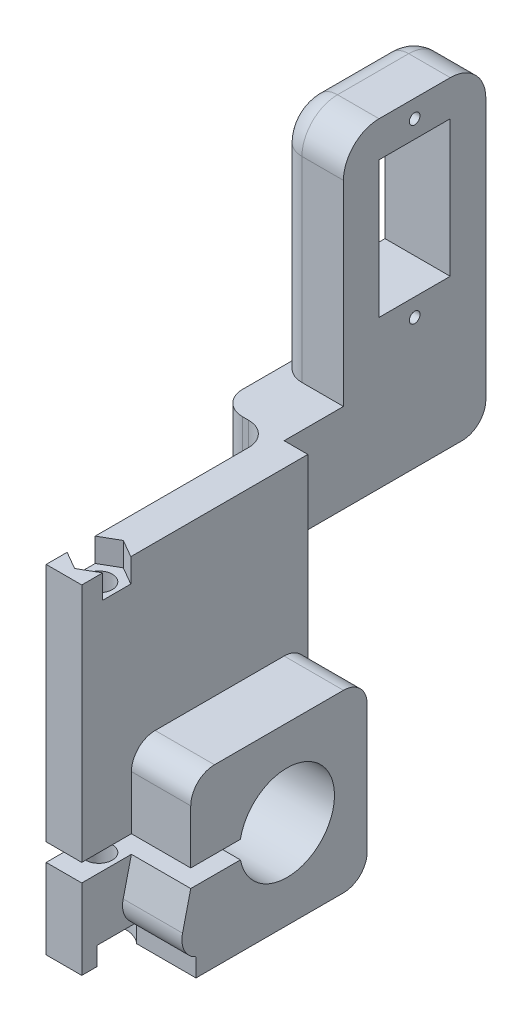
from build123d import *

# Parameters (mm, degrees)
SKETCH1_R                                        = 0.9
SKETCH1_W                                        = 12
SKETCH1_H                                        = 23
BOSS_EXTRUDE1_DEPTH                              = 15
CBORE_FOR_M4_PAN_HEAD_MACHINE_SCREW2_D           = 4.5
CBORE_FOR_M4_PAN_HEAD_MACHINE_SCREW2_CBORE_D     = 9
CBORE_FOR_M4_PAN_HEAD_MACHINE_SCREW2_CBORE_DEPTH = 3.1
CUT_EXTRUDE2_DEPTH                               = 4
SKETCH11_W                                       = 38.11
SKETCH11_H                                       = 57
CUT_EXTRUDE3_DEPTH                               = 9
FILLET3_R                                        = 6
FILLET4_R                                        = 4
BOSS_EXTRUDE2_DEPTH                              = 10
FILLET2_R                                        = 4
SKETCH14_W                                       = 40.700591816
SKETCH14_H                                       = 70
CUT_EXTRUDE4_DEPTH                               = 4


with BuildPart() as part:
    # Sketch1 → Boss-Extrude1 (new body)
    with BuildSketch(Plane(origin=(0, 0, 0), x_dir=(0, 0, -1), z_dir=(1, 0, 0))):
        with BuildLine():
            Line((-58.460295908, -42.411439664), (-41.718412731, -42.411439664))
            ThreePointArc((-41.718412731, -42.411439664), (-25.860295908, -43.911439664), (-41.718412731, -45.411439664))
            Line((-41.718412731, -45.411439664), (-58.460295908, -45.411439664))
            Line((-58.460295908, -45.411439664), (-58.460295908, -58.911439664))
            Line((-58.460295908, -58.911439664), (-20.350295908, -58.911439664))
            Line((-20.350295908, -58.911439664), (-20.350295908, -16.911439664))
            Line((-20.350295908, -16.911439664), (13.649704092, -16.911439664))
            Line((13.649704092, -16.911439664), (13.649704092, 37.088560336))
            Line((13.649704092, 37.088560336), (-10.350295908, 37.088560336))
            Line((-10.350295908, 37.088560336), (-10.350295908, -1.911439664))
            Line((-10.350295908, -1.911439664), (-58.460295908, -1.911439664))
            Line((-58.460295908, -1.911439664), (-58.460295908, -28.911439664))
            Line((-58.460295908, -28.911439664), (-58.460295908, -42.411439664))
        make_face()
        with Locations((1.649704092, 34.088560336)):
            Circle(SKETCH1_R, mode=Mode.SUBTRACT)
        with Locations((1.649704092, 5.088560336)):
            Circle(SKETCH1_R, mode=Mode.SUBTRACT)
        with Locations((1.649704092, 19.588560336)):
            Rectangle(SKETCH1_W, SKETCH1_H, mode=Mode.SUBTRACT)
    extrude(amount=BOSS_EXTRUDE1_DEPTH)

    # CBORE for M4 Pan Head Machine Screw2 (through all)
    with Locations(Plane(origin=(0, -58.911439664, 0), x_dir=(-1, 0, 0), z_dir=(0, -1, 0))):
        with Locations((-12, -52.560295908)):
            CounterBoreHole(CBORE_FOR_M4_PAN_HEAD_MACHINE_SCREW2_D / 2, CBORE_FOR_M4_PAN_HEAD_MACHINE_SCREW2_CBORE_D / 2, CBORE_FOR_M4_PAN_HEAD_MACHINE_SCREW2_CBORE_DEPTH)

    # Sketch7 → Cut-Extrude2 (cut)
    with BuildSketch(Plane(origin=(0, -1.911439664, 0), x_dir=(1, 0, 0), z_dir=(0, 1, 0))):
        Polygon((15.553380664, -50.516569118), (12.006771014, -48.461114589), (8.45339035, -50.504841379), (8.446619336, -54.604022698), (11.993228986, -56.659477227), (15.54660965, -54.615750437), align=None)
    extrude(amount=-CUT_EXTRUDE2_DEPTH, mode=Mode.SUBTRACT)

    # Sketch11 → Cut-Extrude3 (cut)
    with BuildSketch(Plane.ZY):
        with Locations((39.405295908, -30.411439664)):
            Rectangle(SKETCH11_W, SKETCH11_H)
    extrude(amount=-CUT_EXTRUDE3_DEPTH, mode=Mode.SUBTRACT)

    # Fillet3
    fillet3_edges = [part.edges().sort_by_distance(p)[0] for p in [
        (7.5, 37.088560336, 10.350295908),
        (7.5, 37.088560336, -13.649704092),
    ]]
    fillet(fillet3_edges, radius=FILLET3_R)

    # Fillet4
    # the kernel refuses this fillet: 4 mm, written as the material it takes off along each edge
    with BuildSketch(Plane(origin=(0, 31.088560336, 10.350295908), x_dir=(0, 0, -1), z_dir=(0, -1, 0))) as fillet4_piece_1:
        with BuildLine():
            CenterArc((FILLET4_R, FILLET4_R), FILLET4_R, 180, 90)
            Line((0, FILLET4_R), (0, 0))
            Line((0, 0), (FILLET4_R, 0))
        make_face()
    extrude(amount=33, mode=Mode.SUBTRACT)
    with BuildSketch(Plane(origin=(15, 31.088560336, 10.350295908), x_dir=(0, 0, -1), z_dir=(0, -1, 0))) as fillet4_piece_2:
        with BuildLine():
            CenterArc((FILLET4_R, -FILLET4_R), FILLET4_R, 90, 90)
            Line((0, -FILLET4_R), (0, 0))
            Line((0, 0), (FILLET4_R, 0))
        make_face()
    extrude(amount=33, mode=Mode.SUBTRACT)
    with BuildSketch(Plane(origin=(0, 37.088560336, -7.649704092), x_dir=(1, 0, 0), z_dir=(0, 0, 1))) as fillet4_piece_3:
        with BuildLine():
            CenterArc((FILLET4_R, -FILLET4_R), FILLET4_R, 90, 90)
            Line((0, -FILLET4_R), (0, 0))
            Line((0, 0), (FILLET4_R, 0))
        make_face()
    extrude(amount=12, mode=Mode.SUBTRACT)
    with BuildSketch(Plane(origin=(0, 31.088560336, -7.649704092), x_dir=(0, 1, 0), z_dir=(0, 0, 1))) as fillet4_piece_4:
        with BuildLine():
            CenterArc((6 - FILLET4_R, -FILLET4_R), FILLET4_R, 0, 90)
            Line((6, -FILLET4_R), (6, 0))
            Line((6, 0), (6 - FILLET4_R, 0))
        make_face()
    revolve(axis=Axis((0, 31.088560336, -7.649704092), (-1, 0, 0)), revolution_arc=90, mode=Mode.SUBTRACT)
    with BuildSketch(Plane(origin=(0, 31.088560336, 4.350295908), x_dir=(0, 1, 0), z_dir=(0, 0, -1))) as fillet4_piece_5:
        with BuildLine():
            CenterArc((6 - FILLET4_R, FILLET4_R), FILLET4_R, 270, 90)
            Line((6, FILLET4_R), (6, 0))
            Line((6, 0), (6 - FILLET4_R, 0))
        make_face()
    revolve(axis=Axis((0, 31.088560336, 4.350295908), (1, 0, 0)), revolution_arc=90, mode=Mode.SUBTRACT)
    with BuildSketch(Plane(origin=(15, 37.088560336, -7.649704092), x_dir=(-1, 0, 0), z_dir=(0, 0, 1))) as fillet4_piece_6:
        with BuildLine():
            CenterArc((FILLET4_R, FILLET4_R), FILLET4_R, 180, 90)
            Line((0, FILLET4_R), (0, 0))
            Line((0, 0), (FILLET4_R, 0))
        make_face()
    extrude(amount=12, mode=Mode.SUBTRACT)
    with BuildSketch(Plane(origin=(15, 31.088560336, -7.649704092), x_dir=(0, 1, 0), z_dir=(0, 0, 1))) as fillet4_piece_7:
        with BuildLine():
            CenterArc((6 - FILLET4_R, FILLET4_R), FILLET4_R, 270, 90)
            Line((6 - FILLET4_R, 0), (6, 0))
            Line((6, 0), (6, FILLET4_R))
        make_face()
    revolve(axis=Axis((15, 31.088560336, -7.649704092), (-1, 0, 0)), revolution_arc=90, mode=Mode.SUBTRACT)
    with BuildSketch(Plane(origin=(15, 31.088560336, 4.350295908), x_dir=(0, 1, 0), z_dir=(0, 0, -1))) as fillet4_piece_8:
        with BuildLine():
            CenterArc((6 - FILLET4_R, -FILLET4_R), FILLET4_R, 0, 90)
            Line((6 - FILLET4_R, 0), (6, 0))
            Line((6, 0), (6, -FILLET4_R))
        make_face()
    revolve(axis=Axis((15, 31.088560336, 4.350295908), (1, 0, 0)), revolution_arc=90, mode=Mode.SUBTRACT)
    with BuildSketch(Plane(origin=(0, -26.911439664, -13.649704092), x_dir=(0, 0, 1), z_dir=(0, 1, 0))) as fillet4_piece_9:
        with BuildLine():
            CenterArc((FILLET4_R, FILLET4_R), FILLET4_R, 180, 90)
            Line((0, FILLET4_R), (0, 0))
            Line((0, 0), (FILLET4_R, 0))
        make_face()
    extrude(amount=58, mode=Mode.SUBTRACT)
    with BuildSketch(Plane(origin=(-10, -16.911439664, -13.649704092), x_dir=(0, 1, 0), z_dir=(1, 0, 0))) as fillet4_piece_10:
        with BuildLine():
            CenterArc((FILLET4_R, FILLET4_R), FILLET4_R, 180, 90)
            Line((0, FILLET4_R), (0, 0))
            Line((0, 0), (FILLET4_R, 0))
        make_face()
    extrude(amount=35, mode=Mode.SUBTRACT)
    with BuildSketch(Plane(origin=(15, -26.911439664, -13.649704092), x_dir=(0, 0, 1), z_dir=(0, 1, 0))) as fillet4_piece_11:
        with BuildLine():
            CenterArc((FILLET4_R, -FILLET4_R), FILLET4_R, 90, 90)
            Line((0, -FILLET4_R), (0, 0))
            Line((0, 0), (FILLET4_R, 0))
        make_face()
    extrude(amount=58, mode=Mode.SUBTRACT)

    # Sketch13 → Boss-Extrude2 (add)
    with BuildSketch(Plane(origin=(15, 0, 0), x_dir=(0, 0, -1), z_dir=(1, 0, 0))):
        with BuildLine():
            Line((-41.718412731, -42.411439664), (-50.089354319, -42.411439664))
            Line((-50.089354319, -42.411439664), (-50.089354319, -29.340681858))
            Line((-50.089354319, -29.340681858), (-20.350295908, -29.340681858))
            Line((-20.350295908, -29.340681858), (-20.350295908, -58.911439664))
            Line((-20.350295908, -58.911439664), (-49.206193942, -58.911439664))
            Line((-49.206193942, -58.911439664), (-49.206193942, -55.811439664))
            Line((-49.206193942, -55.811439664), (-52.560295908, -55.811439664))
            Line((-52.560295908, -55.811439664), (-50.089354319, -45.411439664))
            Line((-50.089354319, -45.411439664), (-41.718412731, -45.411439664))
            ThreePointArc((-41.718412731, -45.411439664), (-25.860295908, -43.911439664), (-41.718412731, -42.411439664))
        make_face()
    extrude(amount=BOSS_EXTRUDE2_DEPTH)

    # Fillet2
    # the kernel refuses this fillet: 4 mm, written as the material it adds along each edge
    with BuildSketch(Plane(origin=(9, -1.911439664, 20.350295908), x_dir=(-1, 0, 0), z_dir=(0, -1, 0))) as fillet2_piece_1:
        with BuildLine():
            CenterArc((FILLET2_R, -FILLET2_R), FILLET2_R, 90, 90)
            Line((0, -FILLET2_R), (0, 0))
            Line((0, 0), (FILLET2_R, 0))
        make_face()
    extrude(amount=15)
    # the kernel refuses this fillet: 4 mm, written as the material it takes off along each edge
    with BuildSketch(Plane(origin=(35, -58.911439664, 20.350295908), x_dir=(0, 1, 0), z_dir=(-1, 0, 0))) as fillet2_2_piece_1:
        with BuildLine():
            CenterArc((FILLET2_R, -FILLET2_R), FILLET2_R, 90, 90)
            Line((0, -FILLET2_R), (0, 0))
            Line((0, 0), (FILLET2_R, 0))
        make_face()
    extrude(amount=36, mode=Mode.SUBTRACT)
    with BuildSketch(Plane(origin=(0, 8.088560336, 20.350295908), x_dir=(0, 0, -1), z_dir=(0, -1, 0))) as fillet2_2_piece_2:
        with BuildLine():
            CenterArc((FILLET2_R, FILLET2_R), FILLET2_R, 180, 90)
            Line((0, FILLET2_R), (0, 0))
            Line((0, 0), (FILLET2_R, 0))
        make_face()
    extrude(amount=35, mode=Mode.SUBTRACT)
    with BuildSketch(Plane(origin=(15, -55.811439664, 52.560295908), x_dir=(0, 0, -1), z_dir=(1, 0, 0))) as fillet2_2_piece_3:
        with BuildLine():
            CenterArc((4.979691241, 3.654785836), FILLET2_R, 166.634871225, 79.386408779)
            Line((1.088024265, 4.579409084), (0, 0))
            Line((0, 0), (3.354101966, 0))
        make_face()
    extrude(amount=21.76721727, mode=Mode.SUBTRACT)
    with BuildSketch(Plane(origin=(15, -29.340681858, 20.350295908), x_dir=(0, -1, 0), z_dir=(1, 0, 0)), Plane(origin=(15, -29.340681858, 50.089354319), x_dir=(0, 0, -1), z_dir=(1, 0, 0))) as fillet2_2_piece_4:
        with BuildLine():
            CenterArc((FILLET2_R, -FILLET2_R), FILLET2_R, 90, 90)
            Line((0, -FILLET2_R), (0, 0))
            Line((0, 0), (FILLET2_R, 0))
        make_face()
    extrude(amount=20, mode=Mode.SUBTRACT)

    # Sketch14 → Cut-Extrude4 (cut)
    with BuildSketch(Plane(origin=(15, 0, 0), x_dir=(0, 0, -1), z_dir=(1, 0, 0))):
        with Locations((0, 5.659318142)):
            Rectangle(SKETCH14_W, SKETCH14_H)
    extrude(amount=-CUT_EXTRUDE4_DEPTH, mode=Mode.SUBTRACT)


solid = part.part
